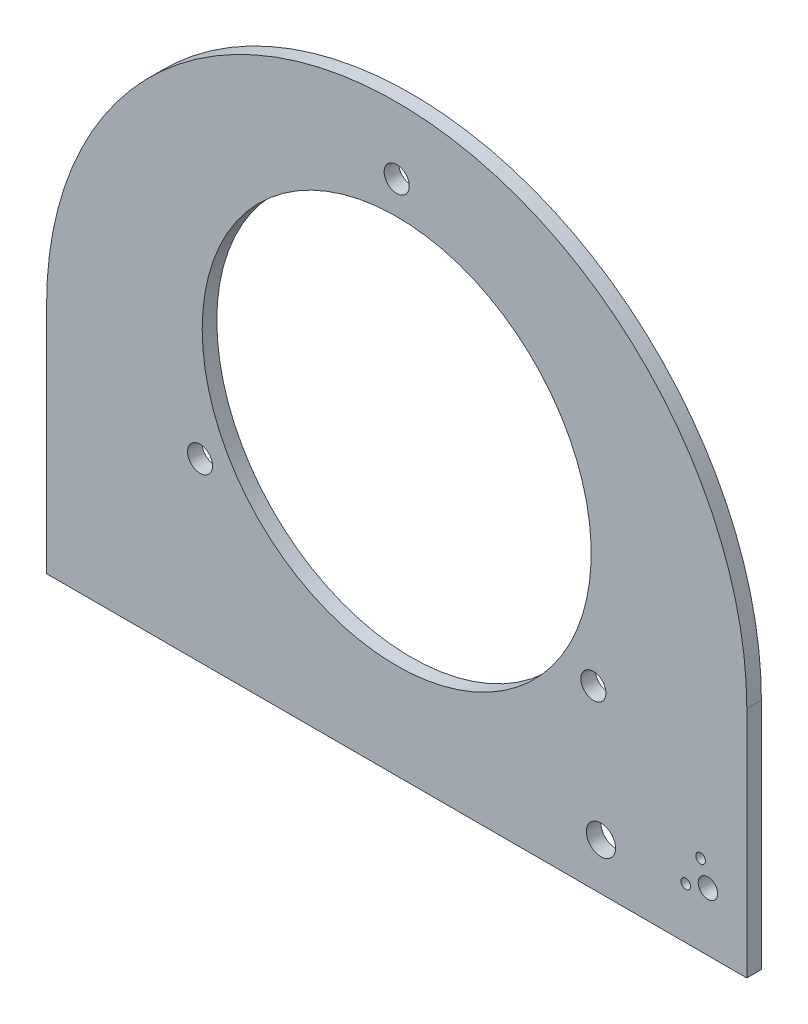
from build123d import *

# Parameters (mm, degrees)
SKETCH1_R           = 127
SKETCH1_R_2         = 8.198770857
SKETCH1_R_3         = 6.35
SKETCH1_R_4         = 3.175
SKETCH1_R_5         = 9.525
BOSS_EXTRUDE1_DEPTH = 9.525


with BuildPart() as part:
    # Sketch1 → Boss-Extrude1 (new body)
    with BuildSketch(Plane.XY):
        with BuildLine():
            Line((-228.6, -36.83), (-228.6, -189.23))
            Line((-228.6, -189.23), (228.6, -189.23))
            Line((228.6, -189.23), (228.6, -36.83))
            ThreePointArc((228.6, -36.83), (0, 191.77), (-228.6, -36.83))
        make_face()
        Circle(SKETCH1_R, mode=Mode.SUBTRACT)
        with Locations((0, 148.2852)):
            Circle(SKETCH1_R_2, mode=Mode.SUBTRACT)
        with Locations((128.418750205, -74.1426)):
            Circle(SKETCH1_R_2, mode=Mode.SUBTRACT)
        with Locations((-128.418750205, -74.1426)):
            Circle(SKETCH1_R_2, mode=Mode.SUBTRACT)
        with Locations((203.2, -151.13)):
            Circle(SKETCH1_R_3, mode=Mode.SUBTRACT)
        with Locations((188.723253344, -155.8925)):
            Circle(SKETCH1_R_4, mode=Mode.SUBTRACT)
        with Locations((198.4375, -136.653253344)):
            Circle(SKETCH1_R_4, mode=Mode.SUBTRACT)
        with Locations((133.35, -158.75)):
            Circle(SKETCH1_R_5, mode=Mode.SUBTRACT)
    extrude(amount=BOSS_EXTRUDE1_DEPTH)


solid = part.part
